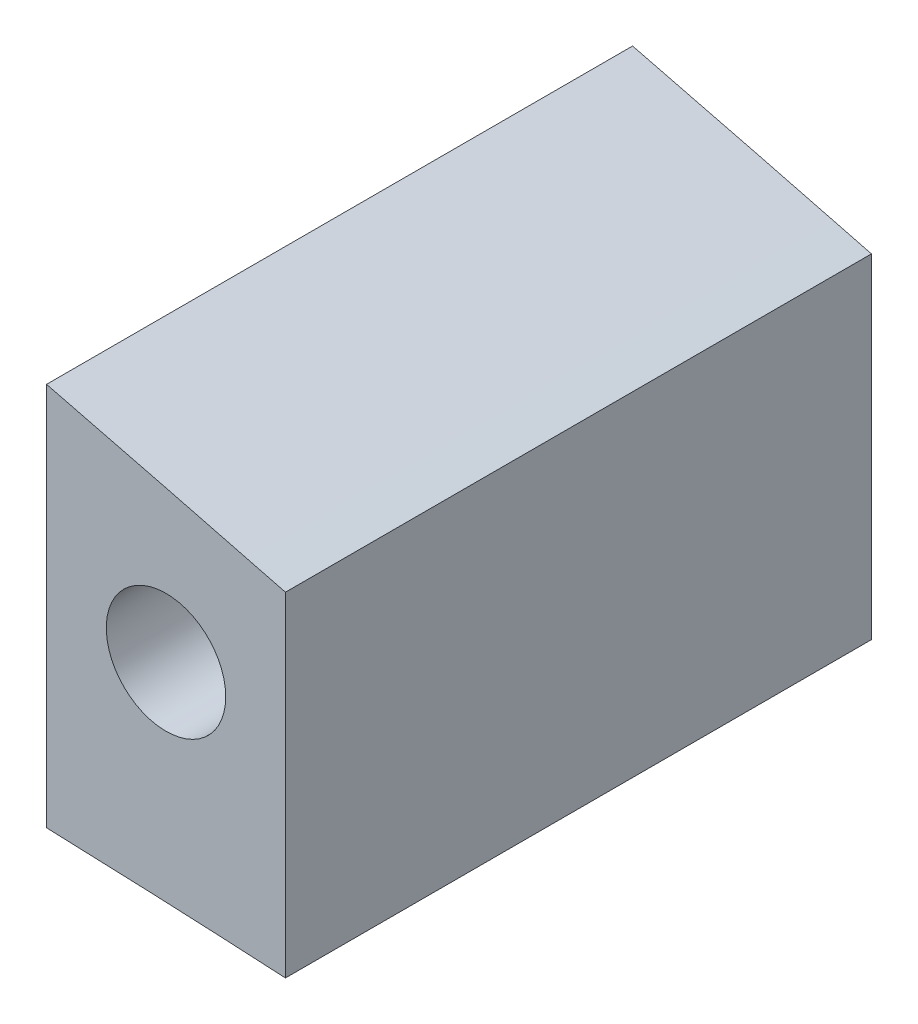
from build123d import *

# Parameters (mm, degrees)
BOSS_EXTRUDE1_DEPTH = 31.1531
SKETCH2_R           = 6.35
SKETCH2_R_2         = 3.175
CUT_EXTRUDE1_DEPTH  = 318.261218693
SKETCH3_W           = 116.84
SKETCH3_H           = 50.8
CUT_EXTRUDE2_DEPTH  = 318.261218693
SKETCH4_W           = 250.150530068
SKETCH4_H           = 117.489254048
CUT_EXTRUDE3_DEPTH  = 241.601180007


with BuildPart() as part:
    # Sketch1 → Boss-Extrude1 (new body)
    with BuildSketch(Plane.XY):
        with BuildLine():
            add(Edge.make_bspline(
                [(0.000560351, 0.000130087), (0.810633127, 7.359196055), (8.649092025, 17.856605174), (26.286719818, 29.975176328), (52.111128271, 42.069215275), (89.597618475, 49.290763054), (131.400792109, 47.884831915), (173.256699242, 40.041104278), (217.961060472, 29.612974894), (256.952064401, 19.528920948), (290.35983767, 8.71099439), (301.273197721, 4.382828139), (314.816918223, -0.516206742), (309.846313895, 0.000130087)],
                knots=[0, 0, 0, 0, 0.060863618, 0.113688265, 0.188608742, 0.312908923, 0.448482434, 0.557612135, 0.691544113, 0.852438279, 0.92975597, 0.976058229, 1, 1, 1, 1], degree=3))
            add(Edge.make_bspline(
                [(309.846313895, 0.000130087), (303.956832565, 1.47095521), (293.989507544, 2.093987313), (276.26402299, 4.514356704), (260.846344817, 5.427413394), (235.858814759, 7.870306192), (205.101424636, 8.838080282), (157.718638092, 9.030650149), (110.497331172, 6.181495223), (66.506197185, -0.586669107), (36.454672816, -6.098499901), (15.316603331, -6.189065841), (1.230714189, -6.924076091), (0.000560351, 0.000130087)],
                knots=[0, 0, 0, 0, 0.057787081, 0.095274891, 0.171021118, 0.205339302, 0.335319146, 0.464904334, 0.658702312, 0.785511947, 0.893517288, 0.94309214, 1, 1, 1, 1], degree=3))
        make_face()
    extrude(amount=BOSS_EXTRUDE1_DEPTH)

    # Sketch2 → Cut-Extrude1 (cut, through all)
    with BuildSketch(Plane.XY.offset(31.1531)):
        with Locations((20.32, 10.16)):
            Circle(SKETCH2_R)
        with Locations((227.296313895, 19.050130087)):
            Circle(SKETCH2_R_2)
    extrude(amount=-CUT_EXTRUDE1_DEPTH, mode=Mode.SUBTRACT)

    # Sketch3 → Cut-Extrude2 (cut, through all)
    with BuildSketch(Plane.XY.offset(31.1531)):
        with Locations((292.066313895, 19.050130087)):
            Rectangle(SKETCH3_W, SKETCH3_H)
    extrude(amount=-CUT_EXTRUDE2_DEPTH, mode=Mode.SUBTRACT)

    # Sketch4 → Cut-Extrude3 (cut, through all)
    with BuildSketch(Plane.XY.offset(31.1531)):
        with Locations((95.871048861, 34.528076629)):
            Rectangle(SKETCH4_W, SKETCH4_H)
    extrude(amount=-CUT_EXTRUDE3_DEPTH, mode=Mode.SUBTRACT)


solid = part.part
